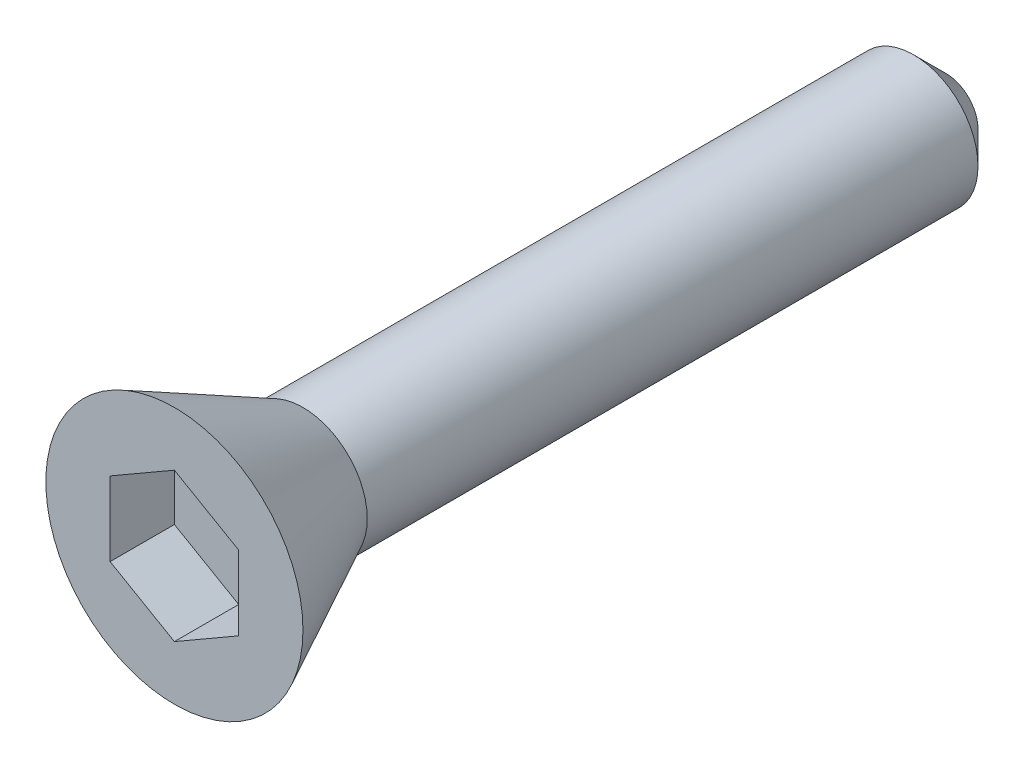
from build123d import *

# Parameters (mm, degrees)
FOOTPRINT_DEPTH = 1
CHAMFER1_SIZE   = 0.5


with BuildPart() as part:
    # Sketch1 → Body (revolve)
    with BuildSketch(Plane(origin=(0, 0, 0), x_dir=(0, 0, -1), z_dir=(1, 0, 0))):
        Polygon((0, 0), (0, 2), (2, 1), (12, 1), (12, 0), align=None)
    revolve(axis=Axis((0, 0, 58.51474448), (0, 0, -1)))

    # Sketch2 → Footprint (cut)
    with BuildSketch(Plane.XY):
        Polygon((0, 1.154700538), (-1, 0.577350269), (-1, -0.577350269), (0, -1.154700538), (1, -0.577350269), (1, 0.577350269), align=None)
    extrude(amount=-FOOTPRINT_DEPTH, mode=Mode.SUBTRACT)

    # Chamfer1
    chamfer1_edges = [part.edges().sort_by_distance(p)[0] for p in [
        (0, -1, -12),
    ]]
    chamfer(chamfer1_edges, length=CHAMFER1_SIZE)


solid = part.part
